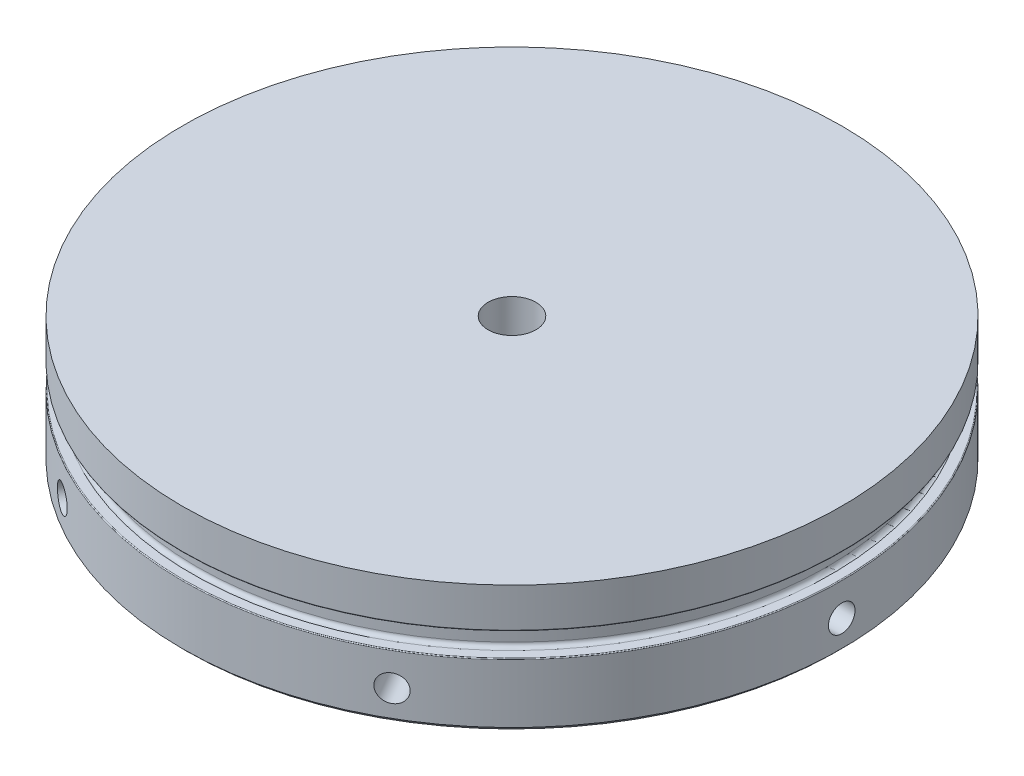
from build123d import *

# Parameters (mm, degrees)
FILLET1_R         = 1.27
FILLET2_R         = 0.254
CHAMFER1_SIZE     = 1.27
CIRPATTERN1_COUNT = 6


with BuildPart() as part:
    # Sketch1 → Revolve1 (revolve)
    with BuildSketch(Plane.XY):
        Polygon((0, 0), (0, 38.1), (-98.3869, 38.1), (-98.3869, 26.1874), (-94.107, 26.1874), (-94.107, 19.05), (-98.3869, 19.05), (-98.3869, 6.551201717), (-98.3869, 0), align=None)
    revolve(axis=Axis((0, 0, 0), (0, 1, 0)))

    # Fillet1
    fillet1_edges = [part.edges().sort_by_distance(p)[0] for p in [
        (94.107, 26.1874, 0),
        (94.107, 19.05, 0),
    ]]
    fillet(fillet1_edges, radius=FILLET1_R)

    # Fillet2
    fillet2_edges = [part.edges().sort_by_distance(p)[0] for p in [
        (98.3869, 19.05, 0),
        (98.3869, 26.1874, 0),
    ]]
    fillet(fillet2_edges, radius=FILLET2_R)

    # Chamfer1
    chamfer1_edges = [part.edges().sort_by_distance(p)[0] for p in [
        (98.3869, 0, 0),
    ]]
    chamfer(chamfer1_edges, length=CHAMFER1_SIZE)

    # Sketch7 → 3/8 NPT Tapped Hole3 (revolve, cut)
    with BuildSketch(Plane(origin=(0, 0, 0), x_dir=(0, 0, -1), z_dir=(1, 0, 0))):
        Polygon((0, 0), (0, 38.1), (7.1374, 38.1), (7.1374, 10.3378), (8.250003024, 10.3378), (8.5727413, 0), align=None)
    revolve(axis=Axis((0, -6.35, 0), (0, 1, 0)), mode=Mode.SUBTRACT)

    # Sketch9 → 3/8-16 Tapped Hole2 (revolve, cut)
    with BuildSketch(Plane(origin=(-98.386823412, 9.105810909, 0.122761999), x_dir=(0.0012477474064568643, 0, 0.9999992215629019), z_dir=(0, 1, 0))):
        Polygon((0, 0), (0, 37.944665582), (3.96875, 35.56), (3.96875, 0), align=None)
    f_3_8_16_tapped_hole2 = revolve(axis=Axis((-104.736818469, 9.105810909, 0.130685195), (0.9999992215629019, 0, -0.0012477474064568645)), mode=Mode.SUBTRACT)

    # CirPattern1: 3/8-16 Tapped Hole2 ×6 about axis
    cirpattern1_axis = Axis((0, 0, 0), (0, -1, 0))
    for i in range(1, CIRPATTERN1_COUNT):
        add(f_3_8_16_tapped_hole2.rotate(cirpattern1_axis, i * 360 / CIRPATTERN1_COUNT), mode=Mode.SUBTRACT)


solid = part.part
